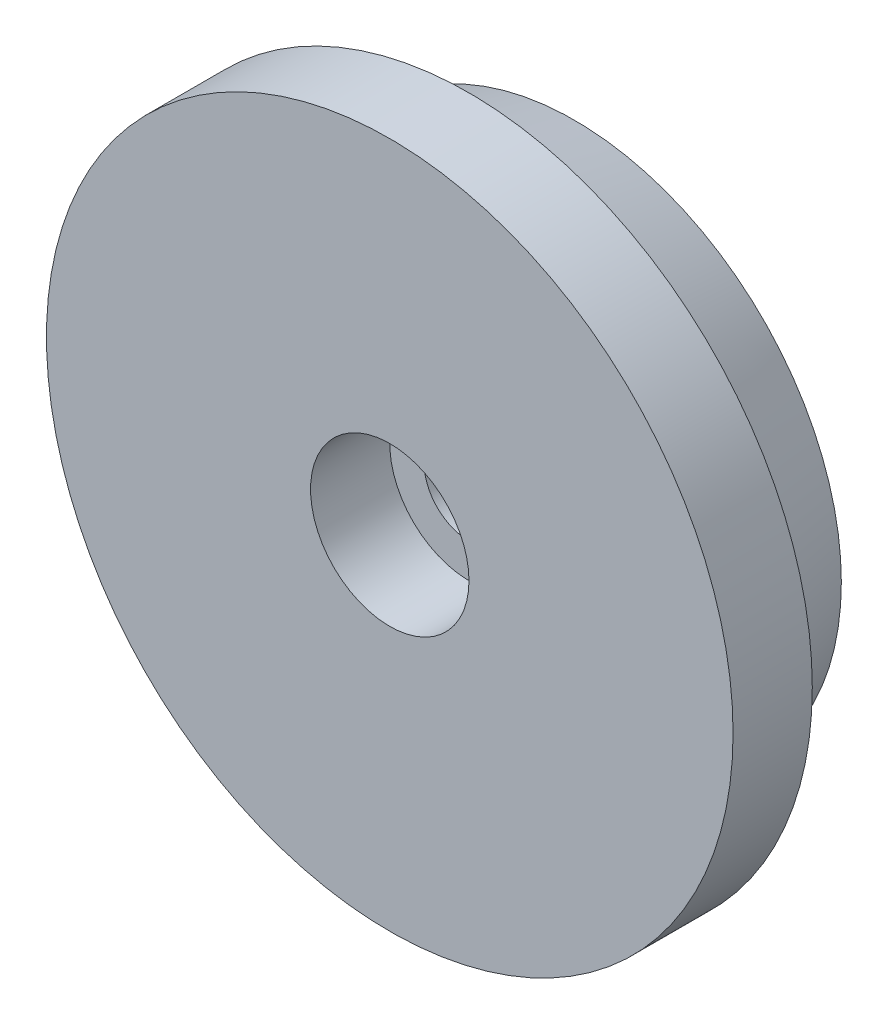
from build123d import *

# Parameters (mm, degrees)
SKETCH1_R           = 13
SKETCH1_R_2         = 3
BOSS_EXTRUDE1_DEPTH = 3
SKETCH2_R           = 11.1
SKETCH2_R_2         = 1.7
BOSS_EXTRUDE2_DEPTH = 4
CHAMFER1_SIZE       = 4
CHAMFER1_SIZE_2     = 1


with BuildPart() as part:
    # Sketch1 → Boss-Extrude1 (new body)
    with BuildSketch(Plane.XY):
        with Locations((132.499999994, -1e-09)):
            Circle(SKETCH1_R)
        with Locations((132.499999994, -1e-09)):
            Circle(SKETCH1_R_2, mode=Mode.SUBTRACT)
    extrude(amount=BOSS_EXTRUDE1_DEPTH)

    # Sketch2 → Boss-Extrude2 (add)
    with BuildSketch(Plane(origin=(0, 0, 0), x_dir=(-1, 0, 0), z_dir=(0, 0, -1))):
        with Locations((-132.5, 0)):
            Circle(SKETCH2_R)
        with Locations((-132.5, 0)):
            Circle(SKETCH2_R_2, mode=Mode.SUBTRACT)
    extrude(amount=BOSS_EXTRUDE2_DEPTH)

    # Chamfer1
    # the kernel refuses this chamfer: 4, 1 mm, written as the material it takes off along each edge
    with BuildSketch(Plane(origin=(132.5, 0, -4), x_dir=(-1, 0, 0), z_dir=(0, -1, 0))) as chamfer1_piece_1_section:
        Polygon((11.1, -CHAMFER1_SIZE), (11.1 - CHAMFER1_SIZE_2, 0), (11.1, 0), align=None)
    chamfer1_piece_1 = revolve(axis=Axis((132.5, 0, -4), (0, 0, -1)), mode=Mode.PRIVATE)
    chamfer1_piece_1 = split(chamfer1_piece_1, bisect_by=Plane(origin=(132.5, 0, 0), z_dir=(0, 0, -1)), keep=Keep.TOP, mode=Mode.PRIVATE)
    add(chamfer1_piece_1, mode=Mode.SUBTRACT)


solid = part.part
